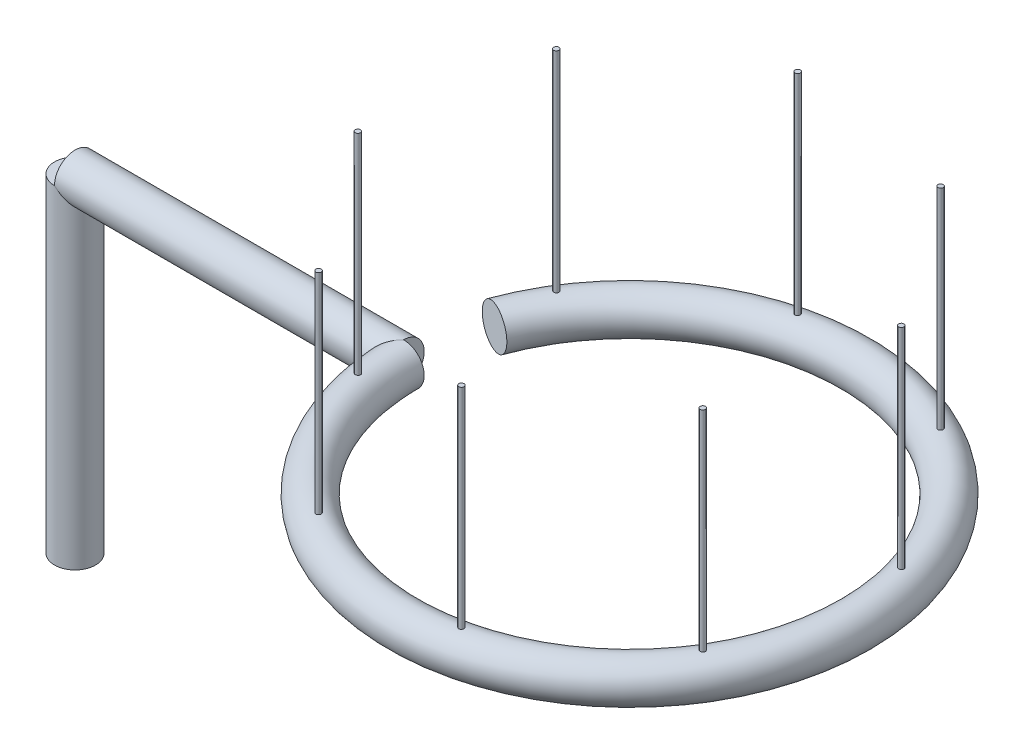
from build123d import *

# Parameters (mm, degrees)
SKETCH1_R           = 3.175
REVOLVE1_ANGLE      = 340
SKETCH2_R           = 0.409575
BOSS_EXTRUDE1_DEPTH = 35.56
CIRPATTERN1_COUNT   = 8
SKETCH7_R           = 3.175
BOSS_EXTRUDE2_DEPTH = 50.8
SKETCH10_R          = 3.175
BOSS_EXTRUDE3_DEPTH = 50.8


with BuildPart() as part:
    # Sketch1 → Revolve1 (revolve)
    with BuildSketch(Plane.XY):
        with Locations((-34.925, 0)):
            Circle(SKETCH1_R)
    revolve(axis=Axis((0, 0, 0), (0, 1, 0)), revolution_arc=REVOLVE1_ANGLE)

    # Sketch2 → Boss-Extrude1 (add)
    with BuildSketch(Plane(origin=(0, 0, 0), x_dir=(1, 0, 0), z_dir=(0, 1, 0))):
        with Locations((-29.697367501, 18.379934399)):
            Circle(SKETCH2_R)
    boss_extrude1 = extrude(amount=BOSS_EXTRUDE1_DEPTH)

    # CirPattern1: Boss-Extrude1 ×8 about axis
    cirpattern1_axis = Axis((0, 0, 0), (0, 1, 0))
    for i in range(1, CIRPATTERN1_COUNT):
        add(boss_extrude1.rotate(cirpattern1_axis, i * 360 / CIRPATTERN1_COUNT))

    # Sketch7 → Boss-Extrude2 (add)
    with BuildSketch(Plane(origin=(-34.925, 0, 0), x_dir=(0, 1, 0), z_dir=(-1, 0, 0))):
        Circle(SKETCH7_R)
    extrude(amount=BOSS_EXTRUDE2_DEPTH)

    # Sketch10 → Boss-Extrude3 (add)
    with BuildSketch(Plane(origin=(0, 0, 0), x_dir=(0, 0, -1), z_dir=(0, 1, 0))):
        with Locations((0, 85.725)):
            Circle(SKETCH10_R)
    extrude(amount=-BOSS_EXTRUDE3_DEPTH)


solid = part.part
